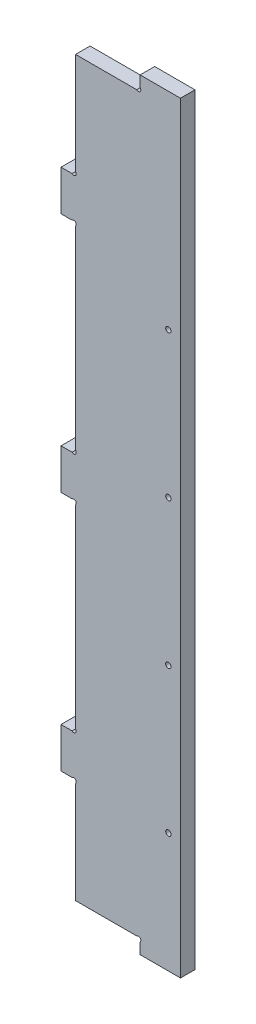
from build123d import *

# Parameters (mm, degrees)
BOSS_EXTRUDE1_DEPTH           = 18
CUT_EXTRUDE1_DEPTH            = 1268.443443295
SKETCH8_W                     = 3.3
SKETCH8_H                     = 18
M6_CLEARANCE_HOLE1_AT_2_COUNT = 2
M6_CLEARANCE_HOLE1_AT_2_PITCH = 828.236516538
M6_CLEARANCE_HOLE1_AT_3_COUNT = 2
M6_CLEARANCE_HOLE1_AT_3_PITCH = 180
M6_CLEARANCE_HOLE1_AT_4_COUNT = 2
M6_CLEARANCE_HOLE1_AT_4_PITCH = 847.570485167
M6_CLEARANCE_HOLE1_AT_5_COUNT = 2
M6_CLEARANCE_HOLE1_AT_5_PITCH = 360
M6_CLEARANCE_HOLE1_AT_6_COUNT = 2
M6_CLEARANCE_HOLE1_AT_6_PITCH = 903.092313845
M6_CLEARANCE_HOLE1_AT_7_COUNT = 2
M6_CLEARANCE_HOLE1_AT_7_PITCH = 540
M6_CLEARANCE_HOLE1_AT_8_COUNT = 2
M6_CLEARANCE_HOLE1_AT_8_PITCH = 988.724292878
SKETCH9_R                     = 3
CUT_EXTRUDE2_DEPTH            = 30
SKETCH10_W                    = 562.346905267
SKETCH10_H                    = 1119.303904093
CUT_EXTRUDE3_DEPTH            = 19


with BuildPart() as part:
    # Sketch1 → Boss-Extrude1 (new body)
    with BuildSketch(Plane.XY):
        Polygon((-961.236516538, 328.950735931), (-961.236516538, 378.950735931), (-943.236516538, 378.950735931), (-943.236516538, 627.901471863), (-961.236516538, 627.901471863), (-961.236516538, 677.901471863), (-943.236516538, 677.901471863), (-943.236516538, 807.901471863), (-863.236516538, 807.901471863), (-863.236516538, 825.901471863), (-813.236516538, 825.901471863), (-813.236516538, 807.901471863), (-439.118258269, 807.901471863), (-439.118258269, 825.901471863), (-389.118258269, 825.901471863), (-389.118258269, 807.901471863), (-15, 807.901471863), (-15, 825.901471863), (35, 825.901471863), (35, 807.901471863), (115, 807.901471863), (115, 677.901471863), (133, 677.901471863), (133, 627.901471863), (115, 627.901471863), (115, 378.950735931), (133, 378.950735931), (133, 328.950735931), (115, 328.950735931), (115, 80), (133, 80), (133, 30), (115, 30), (115, -100), (35, -100), (35, -118), (-15, -118), (-15, -100), (-389.118258269, -100), (-389.118258269, -118), (-439.118258269, -118), (-439.118258269, -100), (-813.236516538, -100), (-813.236516538, -118), (-863.236516538, -118), (-863.236516538, -100), (-943.236516538, -100), (-943.236516538, 30), (-961.236516538, 30), (-961.236516538, 80), (-943.236516538, 80), (-943.236516538, 328.950735931), align=None)
    extrude(amount=BOSS_EXTRUDE1_DEPTH)

    # Sketch2 → Cut-Extrude1 (cut, through all)
    with BuildSketch(Plane(origin=(0, 0, 0), x_dir=(-1, 0, 0), z_dir=(0, 0, -1))):
        Polygon((15, -118), (813.236516538, -118), (813.236516538, 807.901471863), (439.118258269, 807.901471863), (439.118258269, 825.901471863), (389.118258269, 825.901471863), (389.118258269, 807.901471863), (15, 807.901471863), align=None)
    extrude(amount=-CUT_EXTRUDE1_DEPTH, mode=Mode.SUBTRACT)


with BuildPart() as cut_extrude1_piece_1:
    # of the separate pieces the step leaves, piece 1, a body of its own (cut_extrude1_pieces)
    add(part.part.solids().sort_by_distance((-15, -118, 0))[0])


with BuildPart() as cut_extrude1_piece_2:
    # of the separate pieces the step leaves, piece 2, a body of its own (cut_extrude1_pieces)
    add(part.part.solids().sort_by_distance((-961.236516538, 328.950735931, 0))[0])

    # Sketch8 → M6 Clearance Hole1 (revolve, cut)
    with BuildSketch(Plane(origin=(-828.236516538, 30, 18), x_dir=(0, -1, 0), z_dir=(1, 0, 0))):
        with Locations((1.65, 9)):
            Rectangle(SKETCH8_W, SKETCH8_H)
    m6_clearance_hole1 = revolve(axis=Axis((-828.236516538, 30, 24.35), (0, 0, -1)), mode=Mode.SUBTRACT)

    # M6 Clearance Hole1 at 3: M6 Clearance Hole1 ×2
    with Locations(*[(0, i * M6_CLEARANCE_HOLE1_AT_3_PITCH, 0) for i in range(1, M6_CLEARANCE_HOLE1_AT_3_COUNT)]):
        add(m6_clearance_hole1, mode=Mode.SUBTRACT)

    # M6 Clearance Hole1 at 5: M6 Clearance Hole1 ×2
    with Locations(*[(0, i * M6_CLEARANCE_HOLE1_AT_5_PITCH, 0) for i in range(1, M6_CLEARANCE_HOLE1_AT_5_COUNT)]):
        add(m6_clearance_hole1, mode=Mode.SUBTRACT)

    # M6 Clearance Hole1 at 7: M6 Clearance Hole1 ×2
    with Locations(*[(0, i * M6_CLEARANCE_HOLE1_AT_7_PITCH, 0) for i in range(1, M6_CLEARANCE_HOLE1_AT_7_COUNT)]):
        add(m6_clearance_hole1, mode=Mode.SUBTRACT)


with BuildPart() as cut_extrude1_piece_1_1:
    add(cut_extrude1_piece_1.part)

    # M6 Clearance Hole1 at 2: M6 Clearance Hole1 ×2
    with Locations(*[(i * M6_CLEARANCE_HOLE1_AT_2_PITCH, 0, 0) for i in range(1, M6_CLEARANCE_HOLE1_AT_2_COUNT)]):
        add(m6_clearance_hole1, mode=Mode.SUBTRACT)

    # M6 Clearance Hole1 at 4: M6 Clearance Hole1 ×2
    with Locations(*[Vector(0.9771889548210834, 0.2123717179279738, 0) * (i * M6_CLEARANCE_HOLE1_AT_4_PITCH) for i in range(1, M6_CLEARANCE_HOLE1_AT_4_COUNT)]):
        add(m6_clearance_hole1, mode=Mode.SUBTRACT)

    # M6 Clearance Hole1 at 6: M6 Clearance Hole1 ×2
    with Locations(*[Vector(0.9171116881851306, 0.39863034429684335, 0) * (i * M6_CLEARANCE_HOLE1_AT_6_PITCH) for i in range(1, M6_CLEARANCE_HOLE1_AT_6_COUNT)]):
        add(m6_clearance_hole1, mode=Mode.SUBTRACT)

    # M6 Clearance Hole1 at 8: M6 Clearance Hole1 ×2
    with Locations(*[Vector(0.837681973128331, 0.5461583212730776, 0) * (i * M6_CLEARANCE_HOLE1_AT_8_PITCH) for i in range(1, M6_CLEARANCE_HOLE1_AT_8_COUNT)]):
        add(m6_clearance_hole1, mode=Mode.SUBTRACT)


with BuildPart() as cut_extrude2_tool:
    # Sketch9 → Cut-Extrude2 (new body)
    with BuildSketch(Plane(origin=(0, 0, 0), x_dir=(-1, 0, 0), z_dir=(0, 0, -1))):
        with Locations((865.357836881, -102.121320344)):
            Circle(SKETCH9_R)
        with Locations((945.357836881, 27.878679656)):
            Circle(SKETCH9_R)
        with Locations((945.357836881, 82.121320344)):
            Circle(SKETCH9_R)
        with Locations((945.357836881, 326.829415588)):
            Circle(SKETCH9_R)
        with Locations((945.357836881, 381.072056275)):
            Circle(SKETCH9_R)
        with Locations((945.357836881, 625.780151519)):
            Circle(SKETCH9_R)
        with Locations((945.357836881, 680.022792206)):
            Circle(SKETCH9_R)
        with Locations((865.357836881, 810.022792206)):
            Circle(SKETCH9_R)
        with Locations((-37.121320344, 810.022792206)):
            Circle(SKETCH9_R)
        with Locations((-117.121320344, 680.022792206)):
            Circle(SKETCH9_R)
        with Locations((-117.121320344, 625.780151519)):
            Circle(SKETCH9_R)
        with Locations((-117.121320344, 381.072056275)):
            Circle(SKETCH9_R)
        with Locations((-117.121320344, 326.829415588)):
            Circle(SKETCH9_R)
        with Locations((-117.121320344, 82.121320344)):
            Circle(SKETCH9_R)
        with Locations((-117.121320344, 27.878679656)):
            Circle(SKETCH9_R)
        with Locations((-37.121320344, -102.121320344)):
            Circle(SKETCH9_R)
    extrude(amount=-CUT_EXTRUDE2_DEPTH)


with BuildPart() as cut_extrude1_piece_1_2:
    add(cut_extrude1_piece_1_1.part)

    # Cut-Extrude2: cut by cut_extrude2_tool
    add(cut_extrude2_tool.part, mode=Mode.SUBTRACT)

    # Sketch10 → Cut-Extrude3 (cut)
    with BuildSketch(Plane(origin=(0, 0, 0), x_dir=(-1, 0, 0), z_dir=(0, 0, -1))):
        with Locations((-73.449049223, 331.007081051)):
            Rectangle(SKETCH10_W, SKETCH10_H)
    extrude(amount=-CUT_EXTRUDE3_DEPTH, mode=Mode.SUBTRACT)


with BuildPart() as cut_extrude1_piece_2_1:
    add(cut_extrude1_piece_2.part)

    # Cut-Extrude2: cut by cut_extrude2_tool
    add(cut_extrude2_tool.part, mode=Mode.SUBTRACT)


solid = cut_extrude1_piece_2_1.part
